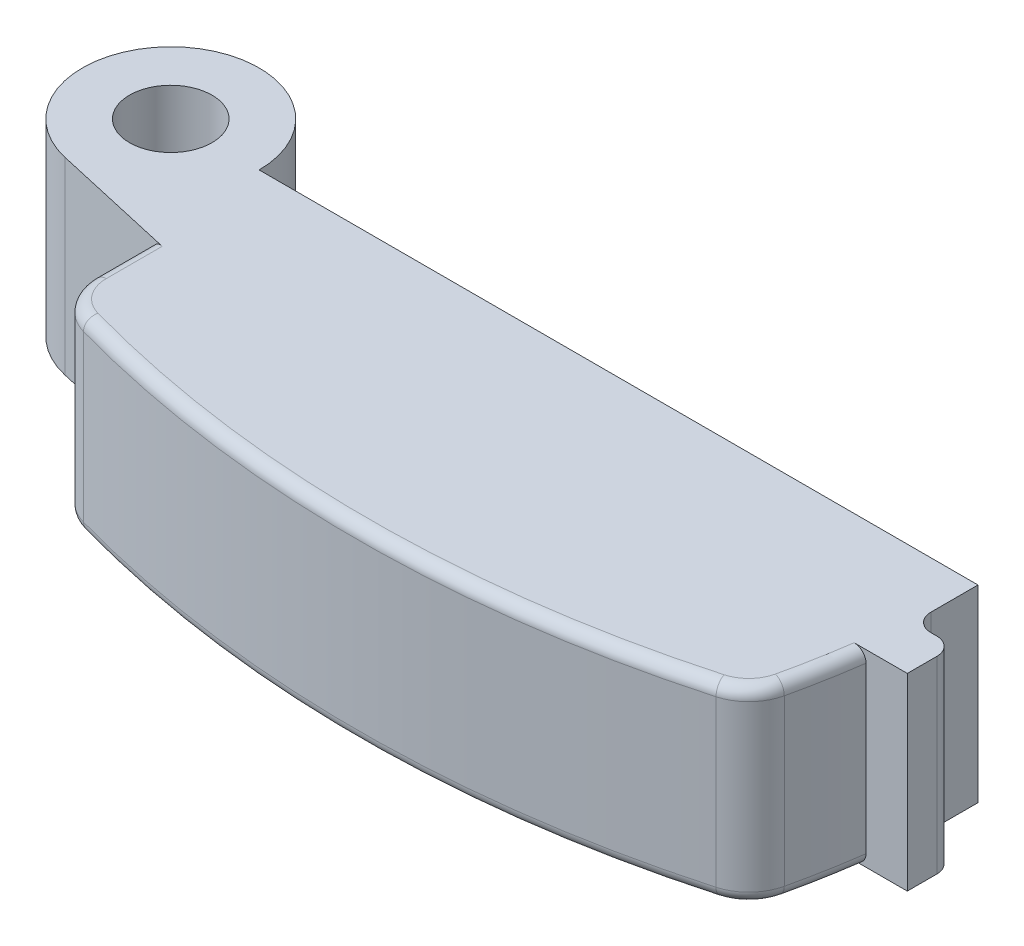
from build123d import *

# Parameters (mm, degrees)
SKETCH1_R           = 1.75
BOSS_EXTRUDE1_DEPTH = 4
SKETCH3_W           = 1.75
SKETCH3_H           = 8
BOSS_EXTRUDE2_DEPTH = 2
FILLET1_R           = 0.5
SKETCH4_W           = 4
SKETCH4_H           = 5
CUT_EXTRUDE1_DEPTH  = 4
FILLET2_R           = 0.75


with BuildPart() as part:
    # Sketch1 → Boss-Extrude1 (new, symmetric)
    with BuildSketch(Plane(origin=(0, 0, 0), x_dir=(1, 0, 0), z_dir=(0, 1, 0))):
        with BuildLine():
            Line((3.75, 0), (34.25, 0))
            Line((34.25, 0), (34.25, -4.75))
            ThreePointArc((34.25, -4.75), (34.013295596, -6.222597745), (33.713306247, -7.68361776))
            ThreePointArc((33.713306247, -7.68361776), (33.210788376, -8.619339874), (32.300045295, -9.165826034))
            ThreePointArc((32.300045295, -9.165826034), (18.881654838, -11), (5.463264382, -9.165826034))
            ThreePointArc((5.463264382, -9.165826034), (4.407286712, -8.448847647), (4, -7.239192993))
            Line((4, -7.239192993), (4, -4.75))
            Line((4, -4.75), (-0.827679139, -3.657519275))
            ThreePointArc((-0.827679139, -3.657519275), (-2.34080149, 2.929701074), (3.75, 0))
        make_face()
        Circle(SKETCH1_R, mode=Mode.SUBTRACT)
    extrude(amount=BOSS_EXTRUDE1_DEPTH, both=True)

    # Sketch3 → Boss-Extrude2 (add)
    with BuildSketch(Plane(origin=(0, 0, 4.75), x_dir=(-1, 0, 0), z_dir=(0, 0, -1))):
        with Locations((-35.125, 0)):
            Rectangle(SKETCH3_W, SKETCH3_H)
    extrude(amount=BOSS_EXTRUDE2_DEPTH)

    # Fillet1
    fillet1_edges = [part.edges().sort_by_distance(p)[0] for p in [
        (4, 4, 5.994596496),
        (4.407286712, 4, 8.448847647),
        (34.013295596, 4, 6.222597745),
        (33.210788376, 4, 8.619339874),
        (4, -4, 5.994596496),
        (4.407286712, -4, 8.448847647),
        (34.013295596, -4, 6.222597745),
        (33.210788376, -4, 8.619339874),
        (18.881654838, 4, 11),
        (18.881654838, -4, 11),
    ]]
    fillet(fillet1_edges, radius=FILLET1_R)

    # Sketch4 → Cut-Extrude1 (cut)
    with BuildSketch(Plane(origin=(0, 0, 0), x_dir=(-1, 0, 0), z_dir=(0, 0, -1))):
        with Locations((-30, 0)):
            Rectangle(SKETCH4_W, SKETCH4_H)
    extrude(amount=-CUT_EXTRUDE1_DEPTH, mode=Mode.SUBTRACT)

    # Fillet2
    fillet2_edges = [part.edges().sort_by_distance(p)[0] for p in [
        (36, 0, 2.75),
        (34.25, 0, 2.75),
    ]]
    fillet(fillet2_edges, radius=FILLET2_R)


solid = part.part
